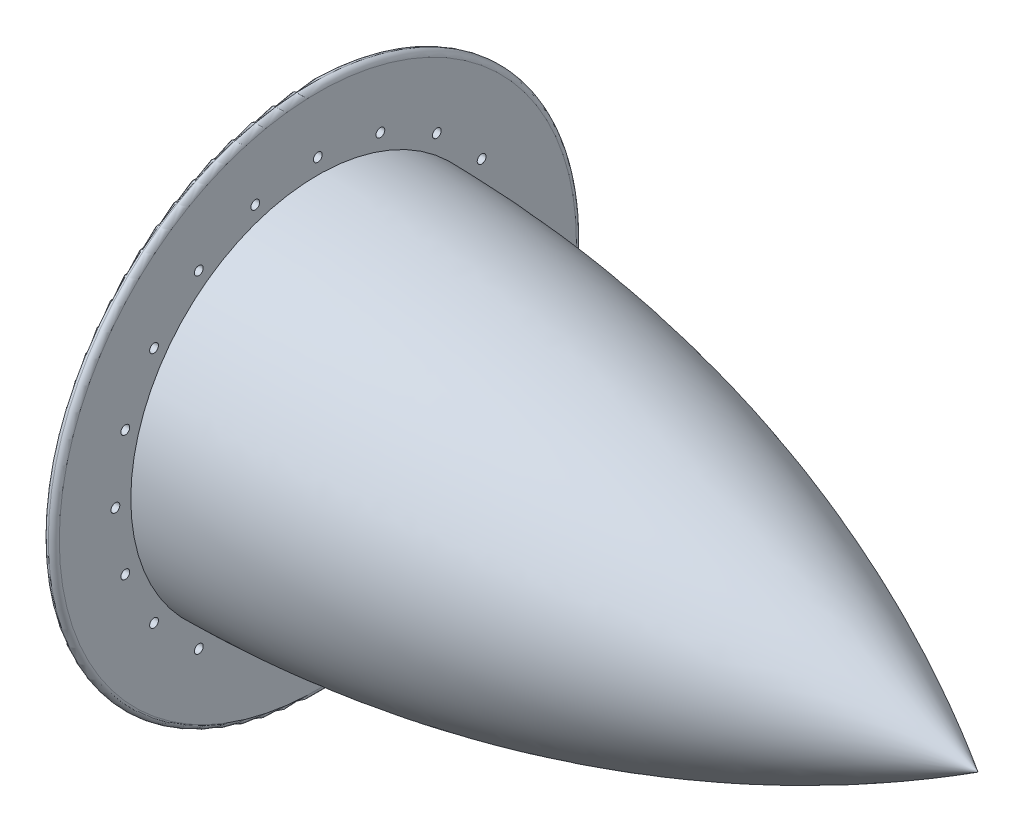
from build123d import *

# Parameters (mm, degrees)
SKETCH3_R           = 120
SKETCH3_R_2         = 79.999716415
BOSS_EXTRUDE1_DEPTH = 5
SKETCH4_R           = 2
CUT_EXTRUDE1_DEPTH  = 5
FILLET1_R           = 2.5


# Read off the part's stored shape, not the designer's step: Shell1
with BuildPart() as part:
    # Sketch1 → Revolve1 (revolve)
    with BuildSketch(Plane.XY):
        with BuildLine():
            Line((-81.642954917, 0), (-81.642954917, 85))
            ThreePointArc((-81.642954917, 85), (74.032115748, 62.529661171), (218.357045083, 0))
            Line((218.357045083, 0), (-81.642954917, 0))
        make_face()
    revolve(axis=Axis((-151.677905646, 0, 0), (1, 0, 0)))

    # Shell1 outline → Shell1 (revolve, cut)
    with BuildSketch(Plane.YX):
        with BuildLine():
            add(Edge.make_bspline(
                [(0, 208.541214165), (78.334802567, 74.017537567), (79.999716415, -81.642954917)],
                knots=[5.755872943, 5.755872943, 5.755872943, 6.272489913, 6.272489913, 6.272489913], degree=2, weights=[1, 0.966823451, 1]))
            Line((0, 208.541214165), (0, -81.642954917))
            Line((0, -81.642954917), (79.999716415, -81.642954917))
        make_face()
    revolve(axis=Axis((0, 0, 0), (1, 0, 0)), mode=Mode.SUBTRACT)

    # Sketch3 → Boss-Extrude1 (add)
    with BuildSketch(Plane.ZY.offset(81.642954917)):
        Circle(SKETCH3_R)
        Circle(SKETCH3_R_2, mode=Mode.SUBTRACT)
    extrude(amount=BOSS_EXTRUDE1_DEPTH)

    # Sketch4 → Cut-Extrude1 (cut)
    with BuildSketch(Plane.ZY.offset(86.642954917)):
        with Locations((0, 92)):
            Circle(SKETCH4_R)
        with Locations((28.429563482, 87.497199499)):
            Circle(SKETCH4_R)
        with Locations((54.076243211, 74.429563482)):
            Circle(SKETCH4_R)
        with Locations((74.429563482, 54.076243211)):
            Circle(SKETCH4_R)
        with Locations((87.497199499, 28.429563482)):
            Circle(SKETCH4_R)
        with Locations((92, 0)):
            Circle(SKETCH4_R)
        with Locations((87.497199499, -28.429563482)):
            Circle(SKETCH4_R)
        with Locations((74.429563482, -54.076243211)):
            Circle(SKETCH4_R)
        with Locations((54.076243211, -74.429563482)):
            Circle(SKETCH4_R)
        with Locations((28.429563482, -87.497199499)):
            Circle(SKETCH4_R)
        with Locations((0, -92)):
            Circle(SKETCH4_R)
        with Locations((-28.429563482, -87.497199499)):
            Circle(SKETCH4_R)
        with Locations((-54.076243211, -74.429563482)):
            Circle(SKETCH4_R)
        with Locations((-74.429563482, -54.076243211)):
            Circle(SKETCH4_R)
        with Locations((-87.497199499, -28.429563482)):
            Circle(SKETCH4_R)
        with Locations((-92, 0)):
            Circle(SKETCH4_R)
        with Locations((-87.497199499, 28.429563482)):
            Circle(SKETCH4_R)
        with Locations((-74.429563482, 54.076243211)):
            Circle(SKETCH4_R)
        with Locations((-54.076243211, 74.429563482)):
            Circle(SKETCH4_R)
        with Locations((-28.429563482, 87.497199499)):
            Circle(SKETCH4_R)
    extrude(amount=-CUT_EXTRUDE1_DEPTH, mode=Mode.SUBTRACT)

    # Fillet1
    fillet1_edges = [part.edges().sort_by_distance(p)[0] for p in [
        (-86.642954917, 0, -120),
        (-81.642954917, 0, -120),
    ]]
    fillet(fillet1_edges, radius=FILLET1_R - 0.0001)  # a hair under: the kernel refuses the full size


solid = part.part
